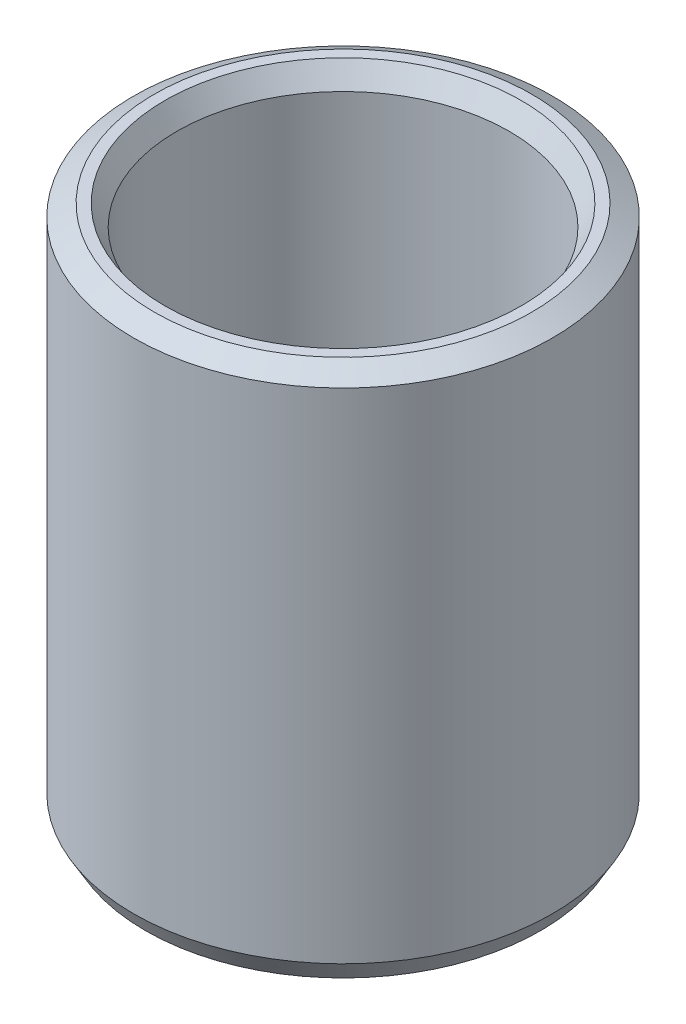
from build123d import *
from OCP.BRepFilletAPI import BRepFilletAPI_MakeChamfer

# Parameters (mm, degrees)
SKETCH1_R           = 60
BOSS_EXTRUDE1_DEPTH = 152.156167681
SKETCH2_R           = 47.571616351
CUT_EXTRUDE1_DEPTH  = 175.216817108
CHAMFER1_SIZE       = 3.427226484
CHAMFER1_SIZE2      = 5.9361304


with BuildPart() as part:
    # Sketch1 → Boss-Extrude1 (new body)
    with BuildSketch(Plane(origin=(0, 0, 0), x_dir=(1, 0, 0), z_dir=(0, 1, 0))):
        Circle(SKETCH1_R)
    extrude(amount=BOSS_EXTRUDE1_DEPTH)

    # Sketch2 → Cut-Extrude1 (cut, through all)
    with BuildSketch(Plane(origin=(0, 0, 0), x_dir=(1, 0, 0), z_dir=(0, 1, 0))):
        Circle(SKETCH2_R)
    extrude(amount=CUT_EXTRUDE1_DEPTH, mode=Mode.SUBTRACT)

    # Chamfer1: one chamfer whose edges measure the first distance from different faces: ONE call of the kernel's chamfer builder (chamfer() names one face for all edges)
    chamfer1_edges_1 = [part.edges().sort_by_distance(p)[0] for p in [
        (-47.571616351, 152.156167681, 0),
    ]]
    chamfer1_side_1 = [part.faces().sort_by_distance(p)[0] for p in [
        (-58.302943725, 152.156167681, 0),
    ]]
    chamfer1_edges_2 = [part.edges().sort_by_distance(p)[0] for p in [
        (-47.571616351, 0, 0),
    ]]
    chamfer1_side_2 = [part.faces().sort_by_distance(p)[0] for p in [
        (-47.571616351, 76.07808384, 0),
    ]]
    chamfer1_edges_3 = [part.edges().sort_by_distance(p)[0] for p in [
        (-60, 0, 0),
    ]]
    chamfer1_side_3 = [part.faces().sort_by_distance(p)[0] for p in [
        (-58.302943725, 0, 0),
    ]]
    chamfer1_edges_4 = [part.edges().sort_by_distance(p)[0] for p in [
        (-60, 152.156167681, 0),
    ]]
    chamfer1_side_4 = [part.faces().sort_by_distance(p)[0] for p in [
        (-60, 76.07808384, 0),
    ]]
    chamfer1 = BRepFilletAPI_MakeChamfer(part.part.solid().wrapped)
    for e in chamfer1_edges_1:
        chamfer1.Add(CHAMFER1_SIZE, CHAMFER1_SIZE2, e.wrapped, chamfer1_side_1[0].wrapped)  # the first distance lies on this face
    for e in chamfer1_edges_2:
        chamfer1.Add(CHAMFER1_SIZE, CHAMFER1_SIZE2, e.wrapped, chamfer1_side_2[0].wrapped)  # the first distance lies on this face
    for e in chamfer1_edges_3:
        chamfer1.Add(CHAMFER1_SIZE, CHAMFER1_SIZE2, e.wrapped, chamfer1_side_3[0].wrapped)  # the first distance lies on this face
    for e in chamfer1_edges_4:
        chamfer1.Add(CHAMFER1_SIZE, CHAMFER1_SIZE2, e.wrapped, chamfer1_side_4[0].wrapped)  # the first distance lies on this face
    add(Compound.cast(chamfer1.Shape()), mode=Mode.REPLACE)


solid = part.part
